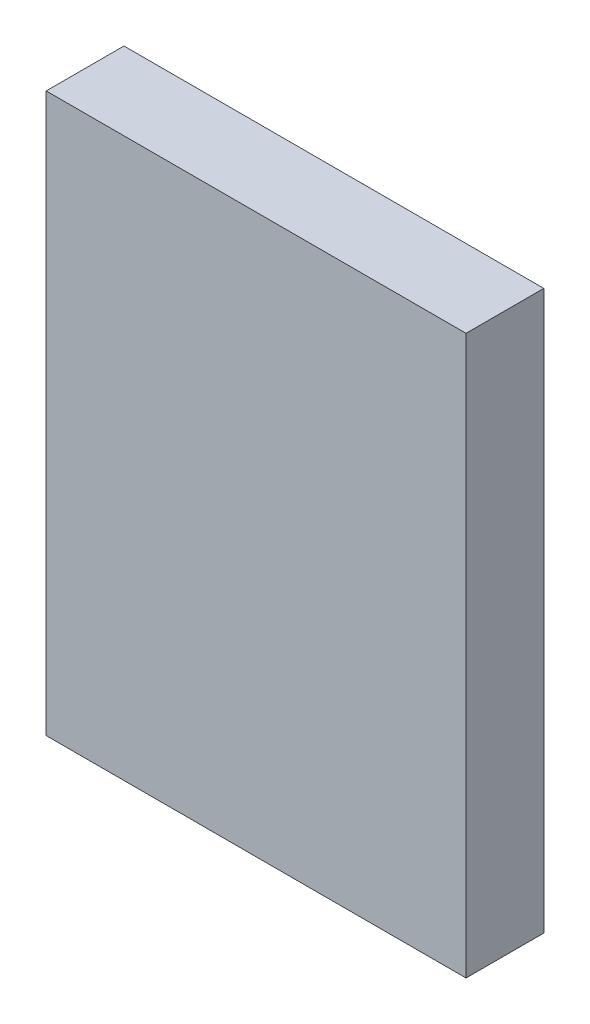
from build123d import *

# Parameters (mm, degrees)
MODEL_W             = 97.14935
MODEL_H             = 129.19946
EXTRUDE_1_DEPTH     = 15
SKETCH_5_W          = 97.14935
SKETCH_5_H          = 129.19946
EXTRUDE_2_DEPTH     = 3
SKETCH_4_W          = 8
SKETCH_4_H          = 25
CUT_EXTRUDE_1_DEPTH = 2


with BuildPart() as part:
    # Model → 凸台-拉伸1 (new body)
    with BuildSketch(Plane.XY):
        with Locations((140.734852429, 91.461726055)):
            Rectangle(MODEL_W, MODEL_H)
        Polygon((102.160177429, 82.384872236), (102.160177429, 94.384872236), (102.160177429, 118.984602236), (102.160177429, 126.061456055), (102.185575181, 151.036037203), (179.309527429, 151.036037203), (179.309527429, 126.061456055), (179.309527429, 118.984602236), (179.309527429, 94.384872236), (179.309527429, 82.384872236), (179.309527429, 35.884872236), (179.309527429, 29.861996055), (139.622022637, 29.861996055), (102.160177429, 29.861996055), (102.160177429, 35.884872236), align=None, mode=Mode.SUBTRACT)
    extrude(amount=EXTRUDE_1_DEPTH)

    # 草图5 → 凸台-拉伸2 (add)
    with BuildSketch(Plane.XY.offset(15)):
        with Locations((140.734852429, 91.461726055)):
            Rectangle(SKETCH_5_W, SKETCH_5_H)
    extrude(amount=EXTRUDE_2_DEPTH)

    # 草图4 → 切除-拉伸1 (cut)
    with BuildSketch(Plane.XY):
        with Locations((98.160177429, 29.884872236)):
            Rectangle(SKETCH_4_W, SKETCH_4_H)
        with Locations((183.309527429, 88.384872236)):
            Rectangle(SKETCH_4_W, SKETCH_4_H)
        with Locations((98.160177429, 88.384872236)):
            Rectangle(SKETCH_4_W, SKETCH_4_H)
        with Locations((183.309527429, 29.884872236)):
            Rectangle(SKETCH_4_W, SKETCH_4_H)
    extrude(amount=CUT_EXTRUDE_1_DEPTH, mode=Mode.SUBTRACT)


solid = part.part
